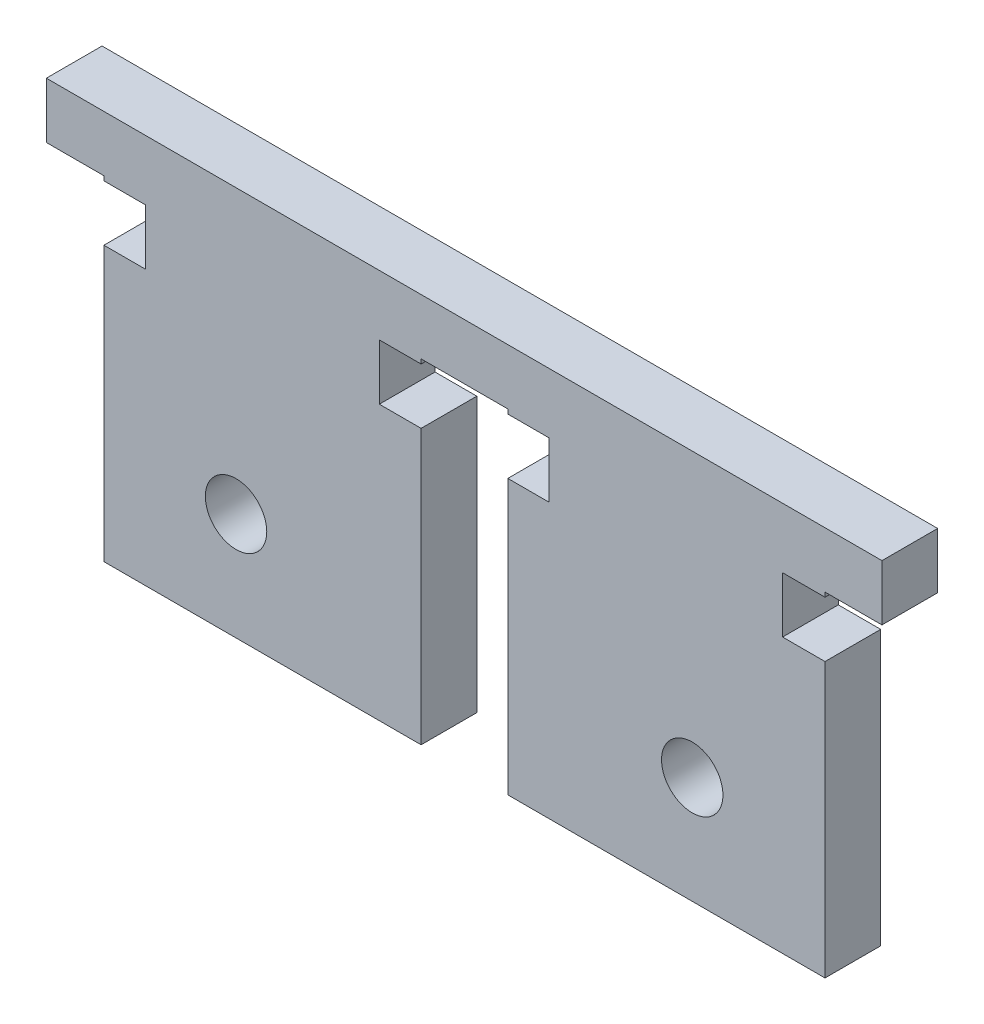
from build123d import *

# Parameters (mm, degrees)
SKETCH3_W            = 95.25
SKETCH3_H            = 60.96
BOSS_EXTRUDE1_DEPTH  = 6.35
SKETCH4_W            = 6.56336
SKETCH4_H            = 45.72
SKETCH4_W_2          = 9.8836988
SKETCH4_W_3          = 6.49224
CUT_EXTRUDE1_DEPTH   = 6.35
SKETCH5_W            = 11.357022159
SKETCH5_H            = 6.35
SKETCH5_W_2          = 4.7625
CUT_EXTRUDE2_DEPTH   = 6.35
SKETCH9_W            = 95.25
SKETCH9_H            = 6.35
CUT_EXTRUDE6_DEPTH   = 8.89
SKETCH11_W           = 82.1944
SKETCH11_H           = 6.35
CUT_EXTRUDE9_DEPTH   = 7.62
M6_CLEARANCE_HOLE2_D = 7


with BuildPart() as part:
    # Sketch3 → Boss-Extrude1 (new body)
    with BuildSketch(Plane.XY):
        Rectangle(SKETCH3_W, SKETCH3_H)
    extrude(amount=BOSS_EXTRUDE1_DEPTH)

    # Sketch4 → Cut-Extrude1 (cut)
    with BuildSketch(Plane.XY.offset(6.35)):
        with Locations((-44.34332, -7.62)):
            Rectangle(SKETCH4_W, SKETCH4_H)
        with Locations((0.03556, -7.62)):
            Rectangle(SKETCH4_W_2, SKETCH4_H)
        with Locations((44.37888, -7.62)):
            Rectangle(SKETCH4_W_3, SKETCH4_H)
    extrude(amount=-CUT_EXTRUDE1_DEPTH, mode=Mode.SUBTRACT)

    # Sketch5 → Cut-Extrude2 (cut)
    with BuildSketch(Plane.XY.offset(6.35)):
        with Locations((-41.97765108, 11.557)):
            Rectangle(SKETCH5_W, SKETCH5_H)
        with Locations((-7.2875394, 11.557)):
            Rectangle(SKETCH5_W_2, SKETCH5_H)
    cut_extrude2 = extrude(amount=-CUT_EXTRUDE2_DEPTH, mode=Mode.SUBTRACT)

    # Mirror1: Cut-Extrude2 across plane
    add(cut_extrude2.mirror(Plane(origin=(0, 0, 0), x_dir=(0, 0, 1), z_dir=(1, 0, 0))), mode=Mode.SUBTRACT)

    # Sketch9 → Cut-Extrude6 (cut)
    with BuildSketch(Plane(origin=(0, 30.48, 0), x_dir=(1, 0, 0), z_dir=(0, 1, 0))):
        with Locations((0, -3.175)):
            Rectangle(SKETCH9_W, SKETCH9_H)
    extrude(amount=-CUT_EXTRUDE6_DEPTH, mode=Mode.SUBTRACT)

    # Sketch11 → Cut-Extrude9 (cut)
    with BuildSketch(Plane.XZ.offset(30.48)):
        with Locations((0.03556, 3.175)):
            Rectangle(SKETCH11_W, SKETCH11_H)
    extrude(amount=-CUT_EXTRUDE9_DEPTH, mode=Mode.SUBTRACT)

    # M6 Clearance Hole2 (through all)
    with Locations(Plane.XY.offset(6.35)):
        with Locations((26, -10.6279), (-26, -10.6279)):
            Hole(M6_CLEARANCE_HOLE2_D / 2)


solid = part.part
